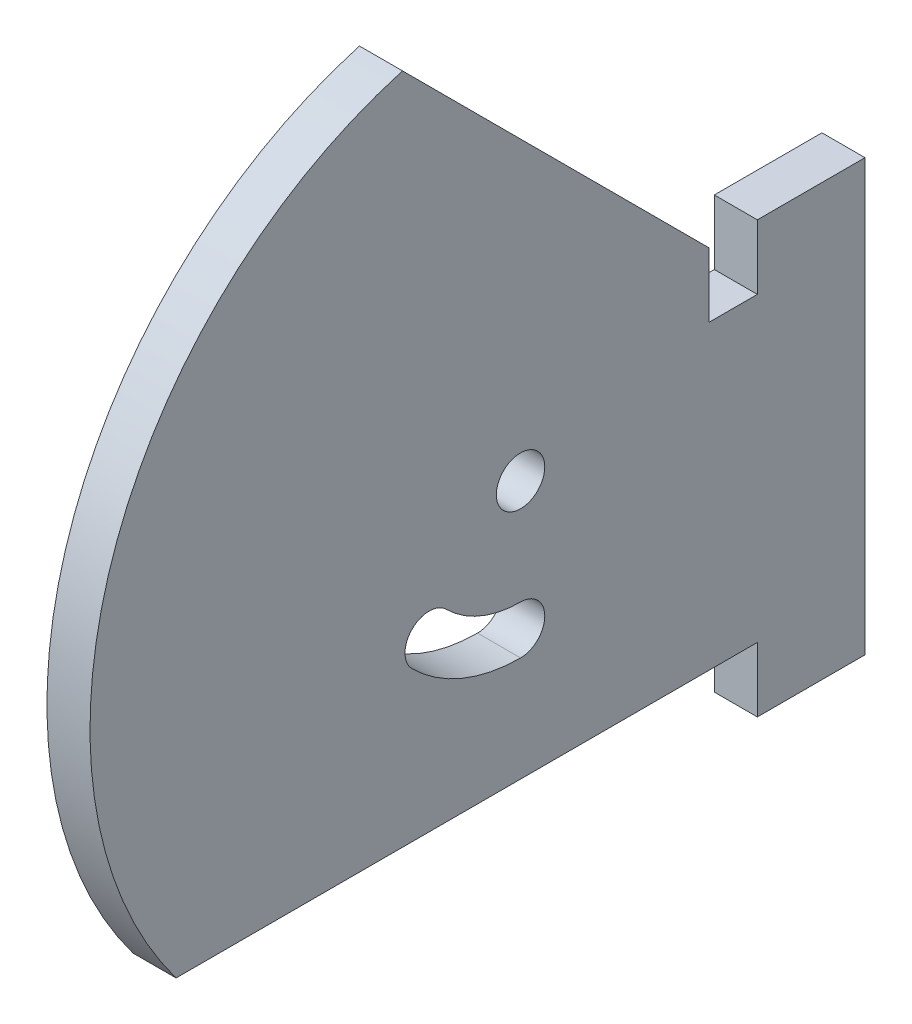
from build123d import *

# Parameters (mm, degrees)
SKETCH1_R           = 1.125
BOSS_EXTRUDE1_DEPTH = 2


with BuildPart() as part:
    # Sketch1 → Boss-Extrude1 (new body)
    with BuildSketch(Plane(origin=(0, 0, 0), x_dir=(0, 0, -1), z_dir=(1, 0, 0))):
        with BuildLine():
            Line((11, 14), (8.75, 14))
            Line((8.75, 14), (8.75, 17))
            Line((8.75, 17), (-5.483574958, 31.233574958))
            ThreePointArc((-5.483574958, 31.233574958), (-18.954420313, 18.382002083), (-16, 0))
            Line((-16, 0), (11, 0))
            Line((11, 0), (11, -3))
            Line((11, -3), (16, -3))
            Line((16, -3), (16, 17))
            Line((16, 17), (11, 17))
            Line((11, 17), (11, 14))
        make_face()
        with BuildLine():
            ThreePointArc((0, 4.875), (-2.726619456, 5.417358331), (-5.038135816, 6.961864184))
            ThreePointArc((-5.038135816, 6.961864184), (-5.038135817, 8.552854441), (-3.44714556, 8.552854444))
            ThreePointArc((-3.44714556, 8.552854444), (-1.865581734, 7.49608728), (-1e-09, 7.125))
            ThreePointArc((-1e-09, 7.125), (1.125, 6), (0, 4.875))
        make_face(mode=Mode.SUBTRACT)
        with Locations((0, 12)):
            Circle(SKETCH1_R, mode=Mode.SUBTRACT)
    extrude(amount=BOSS_EXTRUDE1_DEPTH)


solid = part.part
